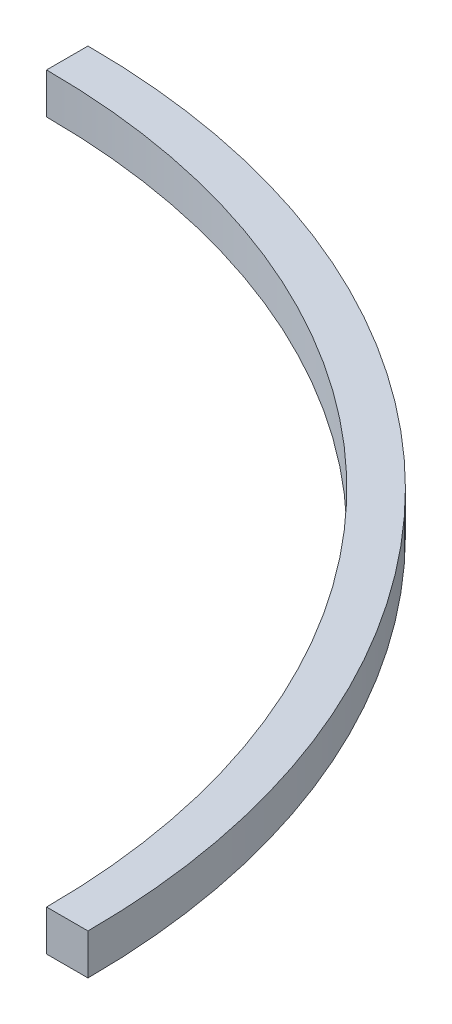
from build123d import *

# Parameters (mm, degrees)
BOSS_EXTRUDE1_DEPTH = 25


with BuildPart() as part:
    # Sketch1 → Boss-Extrude1 (new body)
    with BuildSketch(Plane(origin=(0, 0, 0), x_dir=(1, 0, 0), z_dir=(0, 1, 0))):
        with BuildLine():
            Line((0, 470), (0, 444.6))
            ThreePointArc((0, 444.6), (314.379674916, 314.379674916), (444.6, 0))
            Line((444.6, 0), (470, 0))
            ThreePointArc((470, 0), (332.340187158, 332.340187158), (0, 470))
        make_face()
    extrude(amount=BOSS_EXTRUDE1_DEPTH)


solid = part.part
